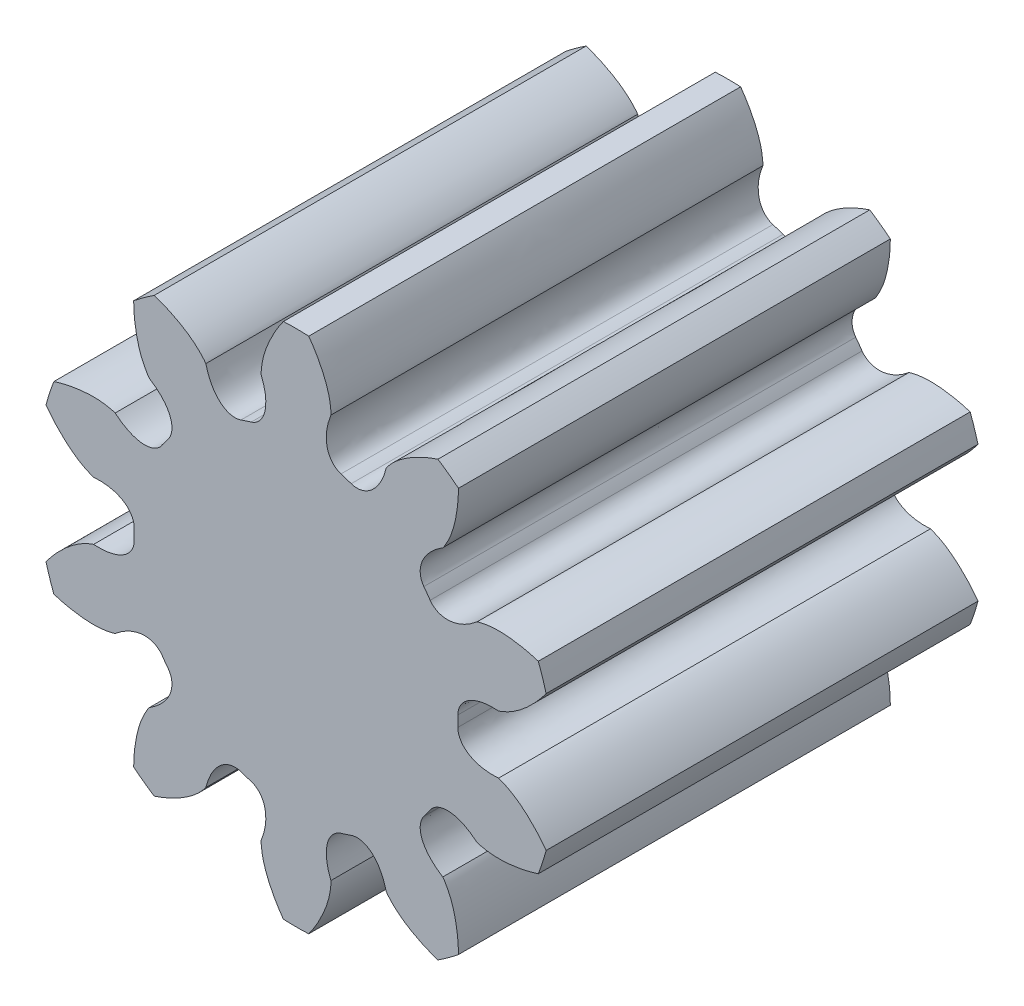
from build123d import *

# Parameters (mm, degrees)
SKETCH_1_R               = 3.75
EXTRUDE_1_DEPTH          = 10
EXTRUDE_START            = -10
EXTRUDE_3_DEPTH          = 10
PATTERN_CIRCULAR_1_COUNT = 10


# Read off the part's stored shape, not the designer's step: 보스-돌출3
with BuildPart() as part:
    # 스케치1 → 보스-돌출1 (new body)
    with BuildSketch(Plane.XY):
        Circle(SKETCH_1_R)
    extrude(amount=EXTRUDE_1_DEPTH)

    # 보스-돌출3 outline → 보스-돌출3 (add)
    with BuildSketch(Plane(origin=(0, 0, 0), x_dir=(-1, 0, 0), z_dir=(0, 0, -1)).offset(EXTRUDE_START)):
        with BuildLine():
            add(Edge.make_bspline(
                [(0.807735899, 4.667039389), (0.779320386, 4.597002174), (0.736010011, 4.467228059), (0.701437651, 4.276961001), (0.697172064, 4.105762966), (0.72354527, 3.944896088), (0.806932811, 3.746122295), (0.934756956, 3.634592899), (1.0397124, 3.602984614)],
                knots=[0.134934918, 0.134934918, 0.134934918, 0.134934918, 0.294852337, 0.423867376, 0.543137928, 0.655874426, 0.766719895, 0.994437161, 0.994437161, 0.994437161, 0.994437161], degree=3))
            add(Edge.make_bspline(
                [(0.807735899, 4.667039389), (0.810379536, 4.704528461), (0.804605725, 4.794197261), (0.776509725, 4.998278406), (0.647729986, 5.42347685), (0.458745144, 5.764365597), (0.293738804, 5.99280548)],
                knots=[0.151758468, 0.151758468, 0.151758468, 0.151758468, 0.210717603, 0.32902849, 0.50001239, 1, 1, 1, 1], degree=3))
            ThreePointArc((0.293738804, 5.99280548), (0, 6), (-0.293738804, 5.99280548))
            add(Edge.make_bspline(
                [(-0.8077359, 4.667039389), (-0.810379536, 4.704528461), (-0.804605725, 4.794197261), (-0.776509725, 4.998278406), (-0.647729986, 5.42347685), (-0.458745144, 5.764365597), (-0.293738804, 5.99280548)],
                knots=[0.151758468, 0.151758468, 0.151758468, 0.151758468, 0.210717603, 0.32902849, 0.50001239, 1, 1, 1, 1], degree=3))
            add(Edge.make_bspline(
                [(-0.8077359, 4.667039389), (-0.779320386, 4.597002174), (-0.736010011, 4.467228059), (-0.701437651, 4.276961001), (-0.697172064, 4.105762966), (-0.72354527, 3.944896088), (-0.806932811, 3.746122295), (-0.934756956, 3.634592899), (-1.0397124, 3.602984614)],
                knots=[0.134934918, 0.134934918, 0.134934918, 0.134934918, 0.294852337, 0.423867376, 0.543137928, 0.655874426, 0.766719895, 0.994437161, 0.994437161, 0.994437161, 0.994437161], degree=3))
            ThreePointArc((-1.0397124, 3.602984614), (0, 3.75), (1.0397124, 3.602984614))
        make_face()
    extrude_3 = extrude(amount=EXTRUDE_3_DEPTH)

    # 원형 패턴1: 보스-돌출3 ×10 about axis
    pattern_circular_1_axis = Axis((0, 0, 10), (0, 0, -1))
    for i in range(1, PATTERN_CIRCULAR_1_COUNT):
        add(extrude_3.rotate(pattern_circular_1_axis, i * 360 / PATTERN_CIRCULAR_1_COUNT))


solid = part.part
